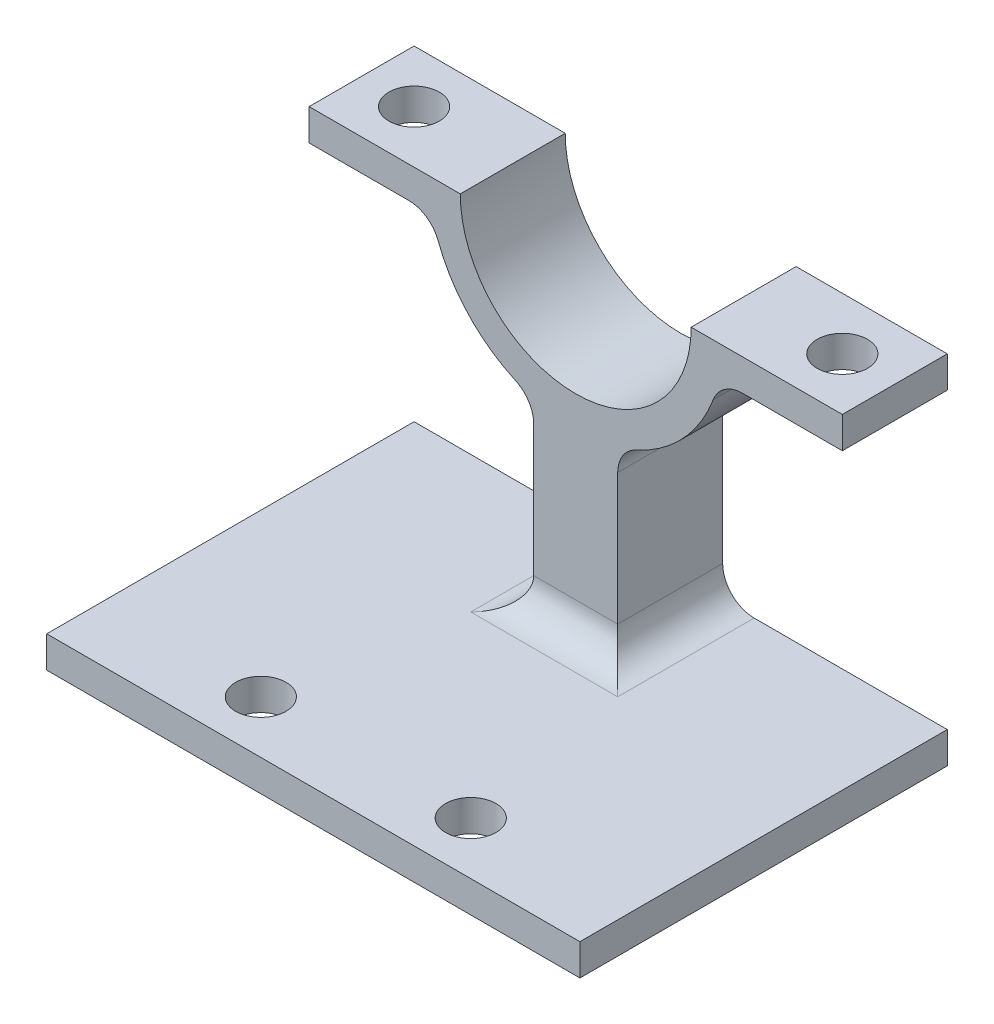
from build123d import *

# Parameters (mm, degrees)
BOSS_EXTRUDE1_DEPTH      = 2.5
SKETCH2_R                = 1.2
CUT_EXTRUDE1_DEPTH       = 15.715298162
BOSS_EXTRUDE2_REACH      = 32.215
BOSS_EXTRUDE2_END_RADIUS = 7
BOSS_EXTRUDE2_START      = -15.5
SKETCH3_W                = 4
SKETCH3_H                = 5
SKETCH4_W                = 25.4
SKETCH4_H                = 17.5
BOSS_EXTRUDE3_DEPTH      = 1.5
FILLET1_R                = 1.5
SKETCH5_R                = 1.2
CUT_EXTRUDE2_DEPTH       = 26.986342567


with BuildPart() as part:
    # Sketch1 → Boss-Extrude1 (new, symmetric)
    with BuildSketch(Plane.XY):
        with BuildLine():
            Line((5.5, 0), (12.7, 0))
            Line((12.7, 0), (12.7, -1.5))
            Line((12.7, -1.5), (6.837397166, -1.5))
            ThreePointArc((6.837397166, -1.5), (0, -7), (-6.837397166, -1.5))
            Line((-6.837397166, -1.5), (-12.7, -1.5))
            Line((-12.7, -1.5), (-12.7, 0))
            Line((-12.7, 0), (-5.5, 0))
            ThreePointArc((-5.5, 0), (0, -5.5), (5.5, 0))
        make_face()
    extrude(amount=BOSS_EXTRUDE1_DEPTH, both=True)

    # Sketch2 → Cut-Extrude1 (cut, through all)
    with BuildSketch(Plane(origin=(0, 0, 0), x_dir=(1, 0, 0), z_dir=(0, 1, 0))):
        with Locations((-10.2, 0)):
            Circle(SKETCH2_R)
        with Locations((10.2, 0)):
            Circle(SKETCH2_R)
    extrude(amount=-CUT_EXTRUDE1_DEPTH, mode=Mode.SUBTRACT)

    # Boss-Extrude2: up to this cylinder (the profile starts outside it)
    boss_extrude2_end = Plane(origin=(0, 0, 0), z_dir=(0, 0, -1)) * Cylinder(BOSS_EXTRUDE2_END_RADIUS, 79.43, mode=Mode.PRIVATE)
    # Sketch3 → Boss-Extrude2 (add, up to the surface)
    with BuildSketch(Plane(origin=(0, 0, 0), x_dir=(1, 0, 0), z_dir=(0, 1, 0)).offset(BOSS_EXTRUDE2_START), mode=Mode.PRIVATE) as boss_extrude2_sk1:
        Rectangle(SKETCH3_W, SKETCH3_H)
    boss_extrude2_tool1 = extrude(boss_extrude2_sk1.sketch, amount=BOSS_EXTRUDE2_REACH, mode=Mode.PRIVATE) - boss_extrude2_end
    add(boss_extrude2_tool1.solids().sort_by_distance((0, -15.5, 0))[0])

    # Sketch4 → Boss-Extrude3 (add)
    with BuildSketch(Plane.XZ.offset(15.5)):
        with Locations((0, 6.25)):
            Rectangle(SKETCH4_W, SKETCH4_H)
    extrude(amount=BOSS_EXTRUDE3_DEPTH)

    # Fillet1
    fillet1_edges = [part.edges().sort_by_distance(p)[0] for p in [
        (2, -15.5, 0),
        (2, -6.708203932, 0),
        (6.837397166, -1.5, 0),
        (-6.837397166, -1.5, 0),
        (-2, -6.708203932, 0),
        (-2, -15.5, 0),
        (0, -15.5, 2.5),
    ]]
    fillet(fillet1_edges, radius=FILLET1_R)

    # Sketch5 → Cut-Extrude2 (cut, through all)
    with BuildSketch(Plane(origin=(0, 0, 0), x_dir=(1, 0, 0), z_dir=(0, 1, 0))):
        with Locations((-5, -12.5)):
            Circle(SKETCH5_R)
        with Locations((5, -12.5)):
            Circle(SKETCH5_R)
    extrude(amount=-CUT_EXTRUDE2_DEPTH, mode=Mode.SUBTRACT)


solid = part.part
